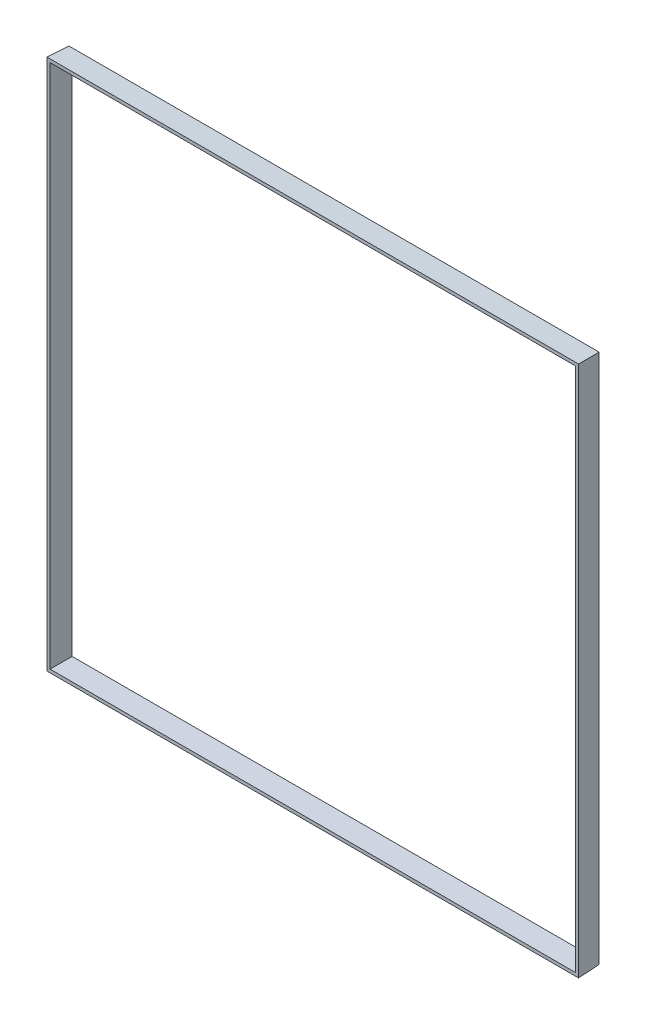
from build123d import *

# Parameters (mm, degrees)
SKETCH2_W                    = 248.7
SKETCH2_H                    = 248.7
BOSS_EXTRUDE1_DEPTH          = 9.98
BOSS_EXTRUDE1_DRAFT          = -2
SKETCH3_W                    = 245.7
SKETCH3_H                    = 245.7
CUT_EXTRUDE1_DEPTH           = 177.140413875
CUT_EXTRUDE1_TAPER           = 2
CUT_EXTRUDE1_OTHER_WAY_DEPTH = 177.140413875


with BuildPart() as part:
    # Sketch2 → Boss-Extrude1 (with draft: the straight prism first)
    with BuildSketch(Plane.XY):
        Rectangle(SKETCH2_W, SKETCH2_H)
    extrude(amount=-BOSS_EXTRUDE1_DEPTH)
    # Boss-Extrude1: the draft: its side faces are tilted about the plane it starts from
    boss_extrude1_sides = [part.faces().sort_by_distance(p)[0] for p in [
        (0, -124.35, -4.99),
        (124.35, 0, -4.99),
        (0, 124.35, -4.99),
        (-124.35, 0, -4.99),
    ]]
    draft(boss_extrude1_sides, Plane.XY, BOSS_EXTRUDE1_DRAFT)

    # Sketch3 → Cut-Extrude1 (cut)
    with BuildSketch(Plane.XY):
        Rectangle(SKETCH3_W, SKETCH3_H)
    extrude(amount=-CUT_EXTRUDE1_DEPTH, taper=CUT_EXTRUDE1_TAPER, mode=Mode.SUBTRACT)

    # Sketch3 → Cut-Extrude1 other way (cut)
    with BuildSketch(Plane.XY):
        Rectangle(SKETCH3_W, SKETCH3_H)
    extrude(amount=CUT_EXTRUDE1_OTHER_WAY_DEPTH, mode=Mode.SUBTRACT)


solid = part.part
